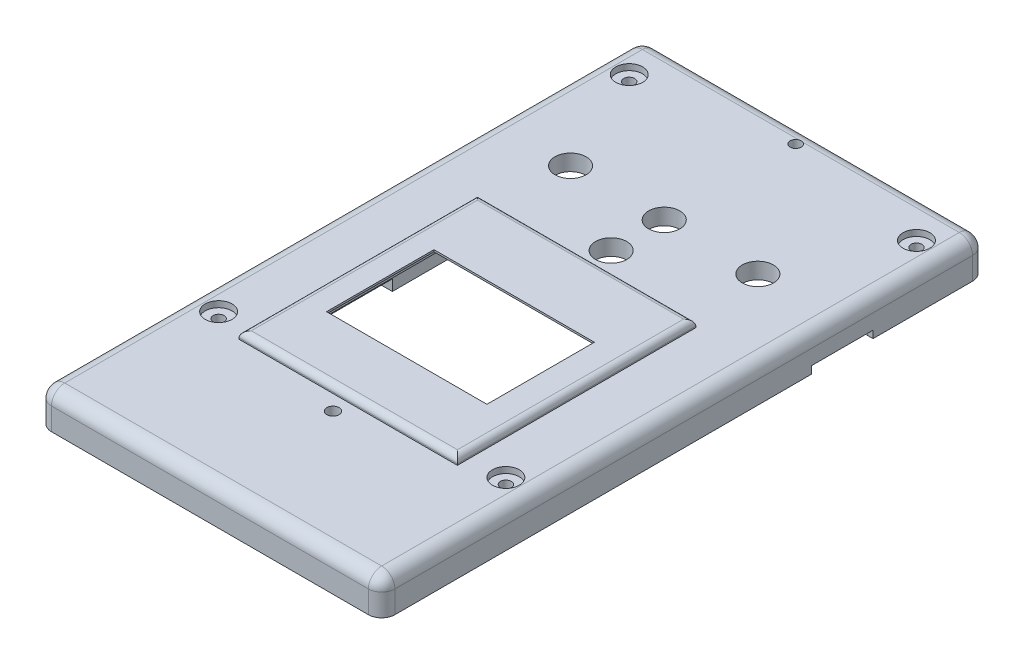
from build123d import *

# Parameters (mm, degrees)
SKETCH1_W                                        = 55.88
SKETCH1_H                                        = 98.298
BOSS_EXTRUDE1_DEPTH                              = 4.99
FILLET1_R                                        = 2.159
CUT_EXTRUDE4_DEPTH                               = 0.5874
CUT_EXTRUDE5_DEPTH                               = 1.778
FILLET4_R                                        = 1.016
CHAMBRAGE_POUR_VIS_T_TE_RONDE_6_PANS_D           = 1.778
CHAMBRAGE_POUR_VIS_T_TE_RONDE_6_PANS_DEPTH       = 6
CHAMBRAGE_POUR_VIS_T_TE_RONDE_6_PANS_CBORE_D     = 4.3688
CHAMBRAGE_POUR_VIS_T_TE_RONDE_6_PANS_CBORE_DEPTH = 0.9906
CHAMBRAGE_POUR_VIS_T_TE_RONDE_6_PANS_TIP         = 0.53416509
SKETCH15_R                                       = 2.54
CUT_EXTRUDE6_DEPTH                               = 57.927612151
SKETCH16_W                                       = 32.848
SKETCH16_H                                       = 37
CUT_EXTRUDE7_DEPTH                               = 4.2
BOSS_EXTRUDE2_DEPTH                              = 0.8
ESQUISSE19_W                                     = 35.53
ESQUISSE19_H                                     = 38.798
BOSS_EXTRU_2_DEPTH                               = 1.2
ESQUISSE1_R                                      = 1
ENL_V_MAT_EXTRU_1_DEPTH                          = 58.161075917
ESQUISSE5_W                                      = 10
ESQUISSE5_H                                      = 1.2
ENL_V_MAT_EXTRU_3_DEPTH                          = 2
ESQUISSE13_W                                     = 27.748
ESQUISSE13_H                                     = 31.15
ENL_V_MAT_EXTRU_6_DEPTH                          = 1.1
ESQUISSE14_R                                     = 0.9
ENL_V_MAT_EXTRU_7_DEPTH                          = 10
ENL_V_MAT_EXTRU_8_REACH                          = 104.379
ESQUISSE15_W                                     = 11.94
ESQUISSE15_H                                     = 0.1
CHANFREIN1_SIZE                                  = 1
CHANFREIN1_SIZE_2                                = 1.191753593
ENL_V_MAT_EXTRU_9_REACH                          = 104.379
ESQUISSE16_W                                     = 11.81
ESQUISSE16_H                                     = 0.5
ESQUISSE17_W                                     = 9
ESQUISSE17_H                                     = 0.8
ENL_V_MAT_EXTRU_10_DEPTH                         = 10
BOSS_EXTRU_1_DEPTH                               = 1.1
CONG_1_R                                         = 0.2
ESQUISSE12_W                                     = 26.098
ESQUISSE12_H                                     = 17.48
ENL_V_MAT_EXTRU_5_DEPTH                          = 22
CONG_2_R                                         = 1


with BuildPart() as part:
    # Sketch1 → Boss-Extrude1 (new body)
    with BuildSketch(Plane(origin=(0, 0, 0), x_dir=(1, 0, 0), z_dir=(0, 1, 0))):
        with Locations((0, -0.381)):
            Rectangle(SKETCH1_W, SKETCH1_H)
    extrude(amount=BOSS_EXTRUDE1_DEPTH)

    # Fillet1
    fillet1_edges = [part.edges().sort_by_distance(p)[0] for p in [
        (27.94, 4.99, 0.381),
        (0, 4.99, -48.768),
        (-27.94, 4.99, 0.381),
        (0, 4.99, 49.53),
        (-27.94, 2.495, -48.768),
        (27.94, 2.495, -48.768),
        (27.94, 2.495, 49.53),
        (-27.94, 2.495, 49.53),
    ]]
    fillet(fillet1_edges, radius=FILLET1_R)

    # Sketch7 → Cut-Extrude4 (cut)
    with BuildSketch(Plane.XZ):
        with BuildLine():
            Line((-25.781, -47.752), (25.781, -47.752))
            ThreePointArc((25.781, -47.752), (26.589223051, -47.417223051), (26.924, -46.609))
            Line((26.924, -46.609), (26.924, 47.371))
            ThreePointArc((26.924, 47.371), (26.589223051, 48.179223051), (25.781, 48.514))
            Line((25.781, 48.514), (-25.781, 48.514))
            ThreePointArc((-25.781, 48.514), (-26.589223051, 48.179223051), (-26.924, 47.371))
            Line((-26.924, 47.371), (-26.924, -46.609))
            ThreePointArc((-26.924, -46.609), (-26.589223051, -47.417223051), (-25.781, -47.752))
        make_face()
    extrude(amount=-CUT_EXTRUDE4_DEPTH, mode=Mode.SUBTRACT)

    # Sketch12 → Cut-Extrude5 (cut)
    with BuildSketch(Plane.XZ.offset(-0.5874)):
        with BuildLine():
            Line((19.812, -38.1), (26.924, -38.1))
            Line((26.924, -38.1), (26.924, -17.145))
            Line((26.924, -17.145), (19.812, -17.145))
            Line((19.812, -17.145), (19.812, -11.275000024))
            Line((19.812, -11.275000024), (22.346000012, -11.275000024))
            Line((22.346000012, -11.275000024), (22.346000012, -3.275))
            Line((22.346000012, -3.275), (26.924, -3.275))
            Line((26.924, -3.275), (26.924, 12.725))
            Line((26.924, 12.725), (22.346000012, 12.725))
            Line((22.346000012, 12.725), (22.346000012, 20.725))
            Line((22.346000012, 20.725), (19.812, 20.725))
            Line((19.812, 20.725), (19.812, 27.94))
            Line((19.812, 27.94), (26.924, 27.94))
            Line((26.924, 27.94), (26.924, 47.371))
            ThreePointArc((26.924, 47.371), (26.589223051, 48.179223051), (25.781, 48.514))
            Line((25.781, 48.514), (8.5725, 48.514))
            Line((8.5725, 48.514), (8.5725, 44.704))
            Line((8.5725, 44.704), (-8.5725, 44.704))
            Line((-8.5725, 44.704), (-8.5725, 48.514))
            Line((-8.5725, 48.514), (-25.781, 48.514))
            ThreePointArc((-25.781, 48.514), (-26.589223051, 48.179223051), (-26.924, 47.371))
            Line((-26.924, 47.371), (-26.924, 27.94))
            Line((-26.924, 27.94), (-16.28, 27.94))
            Line((-16.28, 27.94), (-16.28, 13.727444148))
            Line((-16.28, 13.727444148), (-26.924, 13.727444148))
            Line((-26.924, 13.727444148), (-26.924, 3.429))
            Line((-26.924, 3.429), (-16.28, 3.429))
            Line((-16.28, 3.429), (-16.28, -17.145))
            Line((-16.28, -17.145), (-26.924, -17.145))
            Line((-26.924, -17.145), (-26.924, -38.1))
            Line((-26.924, -38.1), (-19.812, -38.1))
            Line((-19.812, -38.1), (-19.812, -47.752))
            Line((-19.812, -47.752), (19.812, -47.752))
            Line((19.812, -47.752), (19.812, -38.1))
        make_face()
    extrude(amount=-CUT_EXTRUDE5_DEPTH, mode=Mode.SUBTRACT)

    # Fillet4
    fillet4_edges = [part.edges().sort_by_distance(p)[0] for p in [
        (17.17675, 2.3654, 48.514),
        (26.589223051, 2.3654, 48.179223051),
        (26.924, 2.3654, 37.6555),
        (26.924, 2.3654, 4.725),
        (26.924, 2.3654, -27.6225),
        (0, 2.3654, -47.752),
        (-26.924, 2.3654, -27.6225),
        (-26.924, 2.3654, 8.578222074),
        (-26.924, 2.3654, 37.6555),
        (-26.589223051, 2.3654, 48.179223051),
        (-17.17675, 2.3654, 48.514),
    ]]
    fillet(fillet4_edges, radius=FILLET4_R)

    # Chambrage pour vis à tête ronde à 6 pans creux #11
    with Locations(Plane(origin=(0, 4.99, 0), x_dir=(1, 0, 0), z_dir=(0, 1, 0))):
        with Locations((-23.3172, -24.79600016), (23.4188, -24.79600016), (23.4188, 42.00599984), (-23.3172, 42.00599984)):
            CounterBoreHole(CHAMBRAGE_POUR_VIS_T_TE_RONDE_6_PANS_D / 2, CHAMBRAGE_POUR_VIS_T_TE_RONDE_6_PANS_CBORE_D / 2, CHAMBRAGE_POUR_VIS_T_TE_RONDE_6_PANS_CBORE_DEPTH, depth=CHAMBRAGE_POUR_VIS_T_TE_RONDE_6_PANS_DEPTH)
            with Locations((0, 0, -(CHAMBRAGE_POUR_VIS_T_TE_RONDE_6_PANS_DEPTH + CHAMBRAGE_POUR_VIS_T_TE_RONDE_6_PANS_TIP / 2))):  # 118° drill point
                Cone(0, CHAMBRAGE_POUR_VIS_T_TE_RONDE_6_PANS_D / 2, CHAMBRAGE_POUR_VIS_T_TE_RONDE_6_PANS_TIP, mode=Mode.SUBTRACT)

    # Sketch15 → Cut-Extrude6 (cut, through all)
    with BuildSketch(Plane.XZ.offset(-2.3654)):
        with Locations(Location((0, -24.384, 0), (0, 0, 270))):
            Circle(SKETCH15_R)
        with Locations(Location((-15.24, -24.384, 0), (0, 0, 270))):
            Circle(SKETCH15_R)
        with Locations(Location((15.24, -24.384, 0), (0, 0, 270))):
            Circle(SKETCH15_R)
        with Locations(Location((0, -15.748, 0), (0, 0, 270))):
            Circle(SKETCH15_R)
    extrude(amount=-CUT_EXTRUDE6_DEPTH, mode=Mode.SUBTRACT)

    # Sketch16 → Cut-Extrude7 (cut)
    with BuildSketch(Plane(origin=(0, 0.5874, 0), x_dir=(1, 0, 0), z_dir=(0, 1, 0))):
        with Locations((0, -7.264)):
            Rectangle(SKETCH16_W, SKETCH16_H)
    extrude(amount=CUT_EXTRUDE7_DEPTH, mode=Mode.SUBTRACT)

    # Sketch17 → Boss-Extrude2 (add)
    with BuildSketch(Plane.XZ):
        with BuildLine():
            Line((-27.94, 47.371), (-27.94, -46.609))
            ThreePointArc((-27.94, -46.609), (-27.307643541, -48.135643541), (-25.781, -48.768))
            Line((-25.781, -48.768), (25.781, -48.768))
            ThreePointArc((25.781, -48.768), (27.307643541, -48.135643541), (27.94, -46.609))
            Line((27.94, -46.609), (27.94, 47.371))
            ThreePointArc((27.94, 47.371), (27.307643541, 48.897643541), (25.781, 49.53))
            Line((25.781, 49.53), (-25.781, 49.53))
            ThreePointArc((-25.781, 49.53), (-27.307643541, 48.897643541), (-27.94, 47.371))
        make_face()
        with BuildLine():
            Line((-25.781, -47.752), (25.781, -47.752))
            ThreePointArc((25.781, -47.752), (26.589223051, -47.417223051), (26.924, -46.609))
            Line((26.924, -46.609), (26.924, 47.371))
            ThreePointArc((26.924, 47.371), (26.589223051, 48.179223051), (25.781, 48.514))
            Line((25.781, 48.514), (-25.781, 48.514))
            ThreePointArc((-25.781, 48.514), (-26.589223051, 48.179223051), (-26.924, 47.371))
            Line((-26.924, 47.371), (-26.924, -46.609))
            ThreePointArc((-26.924, -46.609), (-26.589223051, -47.417223051), (-25.781, -47.752))
        make_face(mode=Mode.SUBTRACT)
    extrude(amount=BOSS_EXTRUDE2_DEPTH)

    # Esquisse19 → Boss.-Extru.2 (add)
    with BuildSketch(Plane(origin=(0, 4.99, 0), x_dir=(1, 0, 0), z_dir=(0, 1, 0))):
        with Locations((0, -7.631)):
            Rectangle(ESQUISSE19_W, ESQUISSE19_H)
    extrude(amount=BOSS_EXTRU_2_DEPTH)

    # Esquisse1 → Enlèv. mat.-Extru.1 (cut, through all)
    with BuildSketch(Plane(origin=(0, 4.99, 0), x_dir=(1, 0, 0), z_dir=(0, 1, 0))):
        with Locations(Location((0, -29.514, 0), (0, 0, 270))):
            Circle(ESQUISSE1_R)
    extrude(amount=-ENL_V_MAT_EXTRU_1_DEPTH, mode=Mode.SUBTRACT)

    # Esquisse5 → Enlèv. mat.-Extru.3 (cut)
    with BuildSketch(Plane(origin=(27.94, 0, 0), x_dir=(0, 0, -1), z_dir=(1, 0, 0))):
        with Locations((25.418, -0.2)):
            Rectangle(ESQUISSE5_W, ESQUISSE5_H)
    extrude(amount=-ENL_V_MAT_EXTRU_3_DEPTH, mode=Mode.SUBTRACT)

    # Esquisse13 → Enlèv. mat.-Extru.6 (cut)
    with BuildSketch(Plane.XZ.offset(-4.7874)):
        with Locations((-0.25, 8.339)):
            Rectangle(ESQUISSE13_W, ESQUISSE13_H)
    extrude(amount=-ENL_V_MAT_EXTRU_6_DEPTH, mode=Mode.SUBTRACT)

    # Esquisse14 → Enlèv. mat.-Extru.7 (cut)
    with BuildSketch(Plane(origin=(0, 4.99, 0), x_dir=(1, 0, 0), z_dir=(0, 1, 0))):
        with Locations(Location((0, 45.768, 0), (0, 0, 110.861424329))):
            Circle(ESQUISSE14_R)
    extrude(amount=-ENL_V_MAT_EXTRU_7_DEPTH, mode=Mode.SUBTRACT)

    # Esquisse15 → Enlèv. mat.-Extru.8 (cut, up to next)
    with BuildSketch(Plane(origin=(0, 0, -48.768), x_dir=(-1, 0, 0), z_dir=(0, 0, -1)), mode=Mode.PRIVATE) as enl_v_mat_extru_8_sk1:
        with Locations((13.88, -0.75)):
            Rectangle(ESQUISSE15_W, ESQUISSE15_H)
    enl_v_mat_extru_8_tool1 = extrude(enl_v_mat_extru_8_sk1.sketch, amount=-ENL_V_MAT_EXTRU_8_REACH, mode=Mode.PRIVATE) & part.part
    add(enl_v_mat_extru_8_tool1.solids().sort_by_distance((-13.88, -0.75, -48.768))[0], mode=Mode.SUBTRACT)

    # Chanfrein1
    # the kernel refuses this chamfer: 1.191753593, 1 mm, written as the material it takes off along each edge
    with BuildSketch(Plane(origin=(-7.91, -0.7, -48.768), x_dir=(0, 0.9993728857116145, -0.03540953691366555), z_dir=(-1, 0, 0))) as chanfrein1_piece_1:
        Polygon((CHANFREIN1_SIZE * 0.999372885712, -CHANFREIN1_SIZE * 0.0354095369137), (-CHANFREIN1_SIZE_2 * 0.0354095369016, -CHANFREIN1_SIZE_2 * 0.999372885371), (0, 0), align=None)
    extrude(amount=11.94, mode=Mode.SUBTRACT)

    # Esquisse16 → Enlèv. mat.-Extru.9 (cut, up to next)
    with BuildSketch(Plane(origin=(0, 0, -48.768), x_dir=(-1, 0, 0), z_dir=(0, 0, -1)), mode=Mode.PRIVATE) as enl_v_mat_extru_9_sk1:
        with Locations((-12.855, -0.55)):
            Rectangle(ESQUISSE16_W, ESQUISSE16_H)
    enl_v_mat_extru_9_tool1 = extrude(enl_v_mat_extru_9_sk1.sketch, amount=-ENL_V_MAT_EXTRU_9_REACH, mode=Mode.PRIVATE) & part.part
    add(enl_v_mat_extru_9_tool1.solids().sort_by_distance((12.855, -0.55, -48.768))[0], mode=Mode.SUBTRACT)

    # Esquisse17 → Enlèv. mat.-Extru.10 (cut)
    with BuildSketch(Plane(origin=(0, 0, -48.768), x_dir=(-1, 0, 0), z_dir=(0, 0, -1))):
        with Locations((0, -0.4)):
            Rectangle(ESQUISSE17_W, ESQUISSE17_H)
    extrude(amount=-ENL_V_MAT_EXTRU_10_DEPTH, mode=Mode.SUBTRACT)

    # Esquisse18 → Boss.-Extru.1 (add)
    with BuildSketch(Plane(origin=(0, 0, -48.768), x_dir=(-1, 0, 0), z_dir=(0, 0, -1))):
        Polygon((-4.5, -0.8), (-5, -0.8), (-5, 0.5), (5, 0.5), (5, -0.8), (4.5, -0.8), (4.5, 0), (-4.5, 0), align=None)
    extrude(amount=BOSS_EXTRU_1_DEPTH)

    # Congé1
    cong_1_edges = [part.edges().sort_by_distance(p)[0] for p in [
        (-5, -0.15, -49.868),
        (0, 0.5, -49.868),
        (5, -0.15, -49.868),
    ]]
    fillet(cong_1_edges, radius=CONG_1_R)

    # Esquisse12 → Enlèv. mat.-Extru.5 (cut)
    with BuildSketch(Plane(origin=(0, 4.7874, 0), x_dir=(1, 0, 0), z_dir=(0, 1, 0))):
        with Locations((-0.285, -8.484)):
            Rectangle(ESQUISSE12_W, ESQUISSE12_H)
    extrude(amount=ENL_V_MAT_EXTRU_5_DEPTH, mode=Mode.SUBTRACT)

    # Congé2
    cong_2_edges = [part.edges().sort_by_distance(p)[0] for p in [
        (17.765, 6.19, 7.631),
        (0, 6.19, -11.768),
        (-17.765, 6.19, 7.631),
        (0, 6.19, 27.03),
    ]]
    fillet(cong_2_edges, radius=CONG_2_R)


solid = part.part
